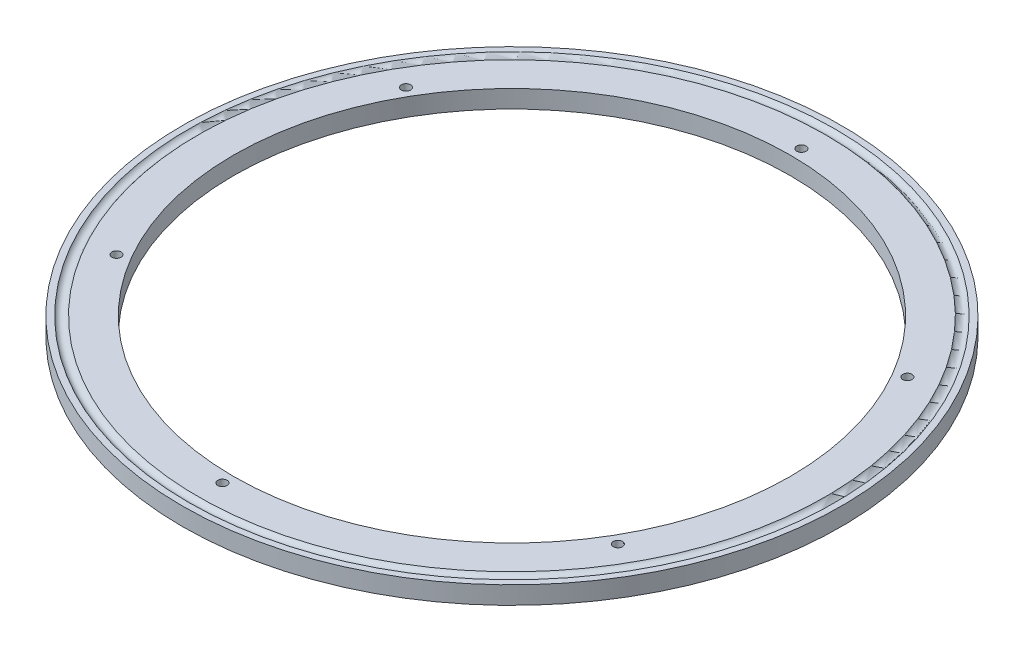
from build123d import *

# Parameters (mm, degrees)
SKETCH1_R           = 93.98
SKETCH1_R_2         = 1.3208
SKETCH1_R_3         = 79.375
BOSS_EXTRUDE1_DEPTH = 5.08


with BuildPart() as part:
    # Sketch1 → Boss-Extrude1 (new body)
    with BuildSketch(Plane(origin=(0, 0, 0), x_dir=(1, 0, 0), z_dir=(0, 1, 0))):
        Circle(SKETCH1_R)
        with Locations((0, 82.55)):
            Circle(SKETCH1_R_2, mode=Mode.SUBTRACT)
        with Locations((0, -82.55)):
            Circle(SKETCH1_R_2, mode=Mode.SUBTRACT)
        with Locations((-71.490397082, -41.275)):
            Circle(SKETCH1_R_2, mode=Mode.SUBTRACT)
        Circle(SKETCH1_R_3, mode=Mode.SUBTRACT)
        with Locations((71.490397082, -41.275)):
            Circle(SKETCH1_R_2, mode=Mode.SUBTRACT)
        with Locations((-71.490397082, 41.275)):
            Circle(SKETCH1_R_2, mode=Mode.SUBTRACT)
        with Locations((71.490397082, 41.275)):
            Circle(SKETCH1_R_2, mode=Mode.SUBTRACT)
    extrude(amount=BOSS_EXTRUDE1_DEPTH)

    # Sketch2 → Cut-Revolve1 (revolve, cut)
    with BuildSketch(Plane(origin=(0, 0, 0), x_dir=(0, 0, -1), z_dir=(1, 0, 0))):
        with BuildLine():
            ThreePointArc((92.196215296, 0), (90.805, 0.762), (89.413784704, 0))
            Line((89.413784704, 0), (92.196215296, 0))
        make_face()
        with BuildLine():
            ThreePointArc((89.413784704, 5.08), (90.805, 4.318), (92.196215296, 5.08))
            Line((92.196215296, 5.08), (89.413784704, 5.08))
        make_face()
    revolve(axis=Axis((0, 0, 0), (0, 1, 0)), mode=Mode.SUBTRACT)


solid = part.part
